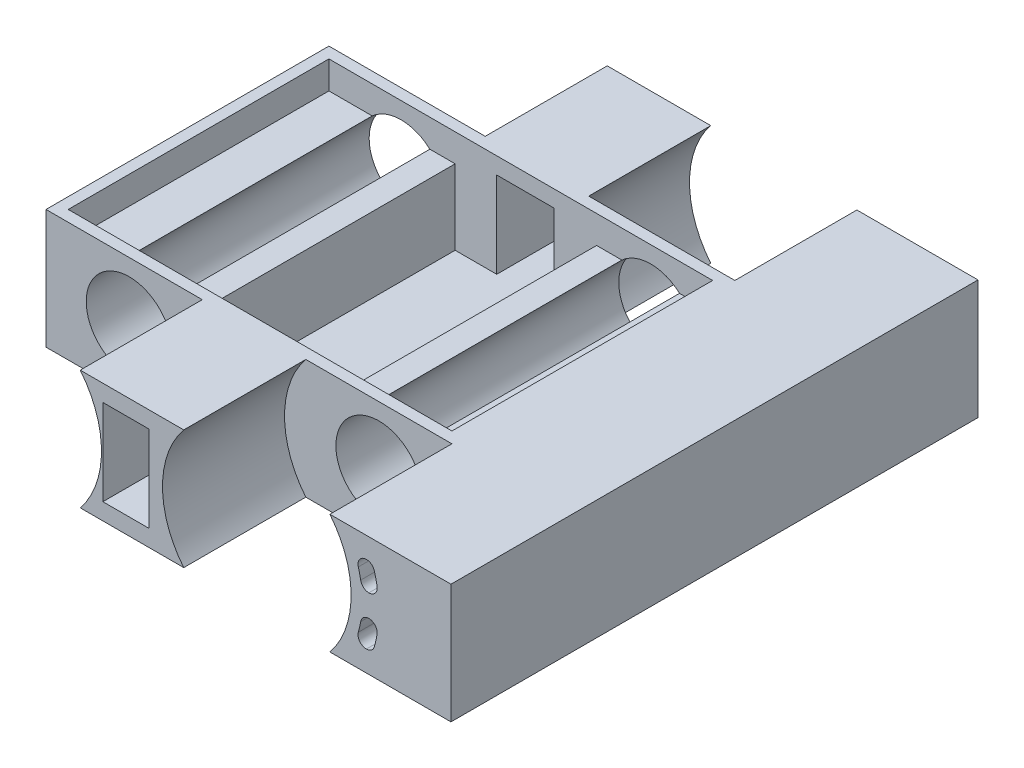
from build123d import *

# Parameters (mm, degrees)
SKETCH1_W           = 95
SKETCH1_H           = 95
BOSS_EXTRUDE1_DEPTH = 25
SKETCH2_R           = 7.75
CUT_EXTRUDE2_DEPTH  = 100
SKETCH3_R           = 17
CUT_EXTRUDE3_DEPTH  = 22
CUT_EXTRUDE4_START  = -22
SKETCH4_R           = 17
CUT_EXTRUDE4_DEPTH  = 22
SKETCH5_W           = 6.246993927
SKETCH5_H           = 25
CUT_EXTRUDE5_DEPTH  = 22
SKETCH6_W           = 7.178723585
SKETCH6_H           = 25
CUT_EXTRUDE6_DEPTH  = 22
SKETCH8_W           = 99.503929421
SKETCH8_H           = 3.5
CUT_EXTRUDE7_DEPTH  = 100
SKETCH9_W           = 8.3
SKETCH9_H           = 15.5
CUT_EXTRUDE11_DEPTH = 100
SKETCH13_W          = 87
SKETCH13_H          = 15.5
CUT_EXTRUDE12_DEPTH = 2
SKETCH14_W          = 25.5
SKETCH14_H          = 47
CUT_EXTRUDE14_DEPTH = 18.5
SKETCH16_W          = 24.75
SKETCH16_H          = 47
CUT_EXTRUDE15_DEPTH = 5
SKETCH17_W          = 20.919567191
SKETCH17_H          = 47
CUT_EXTRUDE16_DEPTH = 5
CUT_EXTRUDE17_DEPTH = 100
FILLET6_R           = 1.5
FILLET7_R           = 1.5
FILLET8_R           = 1.5
FILLET9_R           = 1.5


with BuildPart() as part:
    # Sketch1 → Boss-Extrude1 (new body)
    with BuildSketch(Plane(origin=(0, 0, 0), x_dir=(1, 0, 0), z_dir=(0, 1, 0))):
        with Locations((3.271948822, -17.506298191)):
            Rectangle(SKETCH1_W, SKETCH1_H)
    extrude(amount=BOSS_EXTRUDE1_DEPTH)

    # Sketch2 → Cut-Extrude2 (cut)
    with BuildSketch(Plane.XY.offset(65.006298191)):
        with Locations((-29.228051178, 10.75)):
            Circle(SKETCH2_R)
        with Locations((15.771948822, 10.75)):
            Circle(SKETCH2_R)
    extrude(amount=-CUT_EXTRUDE2_DEPTH, mode=Mode.SUBTRACT)

    # Sketch3 → Cut-Extrude3 (cut)
    with BuildSketch(Plane.XY.offset(65.006298191)):
        with Locations((-29.228051178, 10.75)):
            Circle(SKETCH3_R)
        with Locations((15.771948822, 10.75)):
            Circle(SKETCH3_R)
    extrude(amount=-CUT_EXTRUDE3_DEPTH, mode=Mode.SUBTRACT)

    # Sketch4 → Cut-Extrude4 (cut)
    with BuildSketch(Plane(origin=(0, 0, -29.993701809), x_dir=(-1, 0, 0), z_dir=(0, 0, -1)).offset(CUT_EXTRUDE4_START)):
        with Locations((-15.771948822, 10.75)):
            Circle(SKETCH4_R)
        with Locations((29.228051178, 10.75)):
            Circle(SKETCH4_R)
    extrude(amount=CUT_EXTRUDE4_DEPTH, mode=Mode.SUBTRACT)

    # Sketch5 → Cut-Extrude5 (cut)
    with BuildSketch(Plane.XY.offset(65.006298191)):
        with Locations((-41.104554214, 12.5)):
            Rectangle(SKETCH5_W, SKETCH5_H)
    extrude(amount=-CUT_EXTRUDE5_DEPTH, mode=Mode.SUBTRACT)

    # Sketch6 → Cut-Extrude6 (cut)
    with BuildSketch(Plane(origin=(0, 0, -29.993701809), x_dir=(-1, 0, 0), z_dir=(0, 0, -1))):
        with Locations((40.638689386, 12.5)):
            Rectangle(SKETCH6_W, SKETCH6_H)
    extrude(amount=-CUT_EXTRUDE6_DEPTH, mode=Mode.SUBTRACT)

    # Sketch8 → Cut-Extrude7 (cut)
    with BuildSketch(Plane(origin=(0, 0, -29.993701809), x_dir=(-1, 0, 0), z_dir=(0, 0, -1))):
        with Locations((-1.019984112, 23.25)):
            Rectangle(SKETCH8_W, SKETCH8_H)
    extrude(amount=-CUT_EXTRUDE7_DEPTH, mode=Mode.SUBTRACT)

    # Sketch9 → Cut-Extrude11 (cut)
    with BuildSketch(Plane.XY.offset(65.006298191)):
        with Locations((-7.828051178, 10.75)):
            Rectangle(SKETCH9_W, SKETCH9_H)
    extrude(amount=-CUT_EXTRUDE11_DEPTH, mode=Mode.SUBTRACT)

    # Sketch13 → Cut-Extrude12 (cut)
    with BuildSketch(Plane.ZY.offset(3.678051178)):
        with Locations((17.506298191, 10.75)):
            Rectangle(SKETCH13_W, SKETCH13_H)
    extrude(amount=-CUT_EXTRUDE12_DEPTH, mode=Mode.SUBTRACT)

    # Sketch14 → Cut-Extrude14 (cut)
    with BuildSketch(Plane(origin=(0, 21.5, 0), x_dir=(1, 0, 0), z_dir=(0, 1, 0))):
        with Locations((-6.728051178, -17.506298191)):
            Rectangle(SKETCH14_W, SKETCH14_H)
    extrude(amount=-CUT_EXTRUDE14_DEPTH, mode=Mode.SUBTRACT)

    # Sketch16 → Cut-Extrude15 (cut)
    with BuildSketch(Plane(origin=(0, 21.5, 0), x_dir=(1, 0, 0), z_dir=(0, 1, 0))):
        with Locations((-29.853051178, -17.506298191)):
            Rectangle(SKETCH16_W, SKETCH16_H)
    extrude(amount=-CUT_EXTRUDE15_DEPTH, mode=Mode.SUBTRACT)

    # Sketch17 → Cut-Extrude16 (cut)
    with BuildSketch(Plane(origin=(0, 21.5, 0), x_dir=(1, 0, 0), z_dir=(0, 1, 0))):
        with Locations((16.481732418, -17.506298191)):
            Rectangle(SKETCH17_W, SKETCH17_H)
    extrude(amount=-CUT_EXTRUDE16_DEPTH, mode=Mode.SUBTRACT)

    # Sketch18 → Cut-Extrude17 (cut)
    with BuildSketch(Plane.XY.offset(65.006298191)):
        with BuildLine():
            Line((34.66639245, 12.75), (37.680851122, 12.75))
            ThreePointArc((37.680851122, 12.75), (37.300376381, 15.28065192), (36.628602437, 17.75))
            Line((36.628602437, 17.75), (33.435470555, 17.75))
            ThreePointArc((33.435470555, 17.75), (34.221100776, 15.291893017), (34.66639245, 12.75))
        make_face()
        with BuildLine():
            Line((34.66639245, 8.75), (37.680851122, 8.75))
            ThreePointArc((37.680851122, 8.75), (37.300376381, 6.21934808), (36.628602437, 3.75))
            Line((36.628602437, 3.75), (33.435470555, 3.75))
            ThreePointArc((33.435470555, 3.75), (34.221100776, 6.208106983), (34.66639245, 8.75))
        make_face()
    extrude(amount=-CUT_EXTRUDE17_DEPTH, mode=Mode.SUBTRACT)

    # Fillet6
    fillet6_edges = [part.edges().sort_by_distance(p)[0] for p in [
        (33.435470555, 17.75, 17.506298191),
        (36.628602437, 17.75, 17.506298191),
    ]]
    fillet(fillet6_edges, radius=FILLET6_R - 0.0001)  # a hair under: the kernel refuses the full size

    # Fillet7
    fillet7_edges = [part.edges().sort_by_distance(p)[0] for p in [
        (37.680851122, 12.75, 17.506298191),
        (34.66639245, 12.75, 17.506298191),
    ]]
    fillet(fillet7_edges, radius=FILLET7_R - 0.0001)  # a hair under: the kernel refuses the full size

    # Fillet8
    fillet8_edges = [part.edges().sort_by_distance(p)[0] for p in [
        (33.435470555, 3.75, 17.506298191),
        (36.628602437, 3.75, 17.506298191),
    ]]
    fillet(fillet8_edges, radius=FILLET8_R - 0.0001)  # a hair under: the kernel refuses the full size

    # Fillet9
    fillet9_edges = [part.edges().sort_by_distance(p)[0] for p in [
        (37.680851122, 8.75, 17.506298191),
        (34.66639245, 8.75, 17.506298191),
    ]]
    fillet(fillet9_edges, radius=FILLET9_R - 0.0001)  # a hair under: the kernel refuses the full size


solid = part.part
